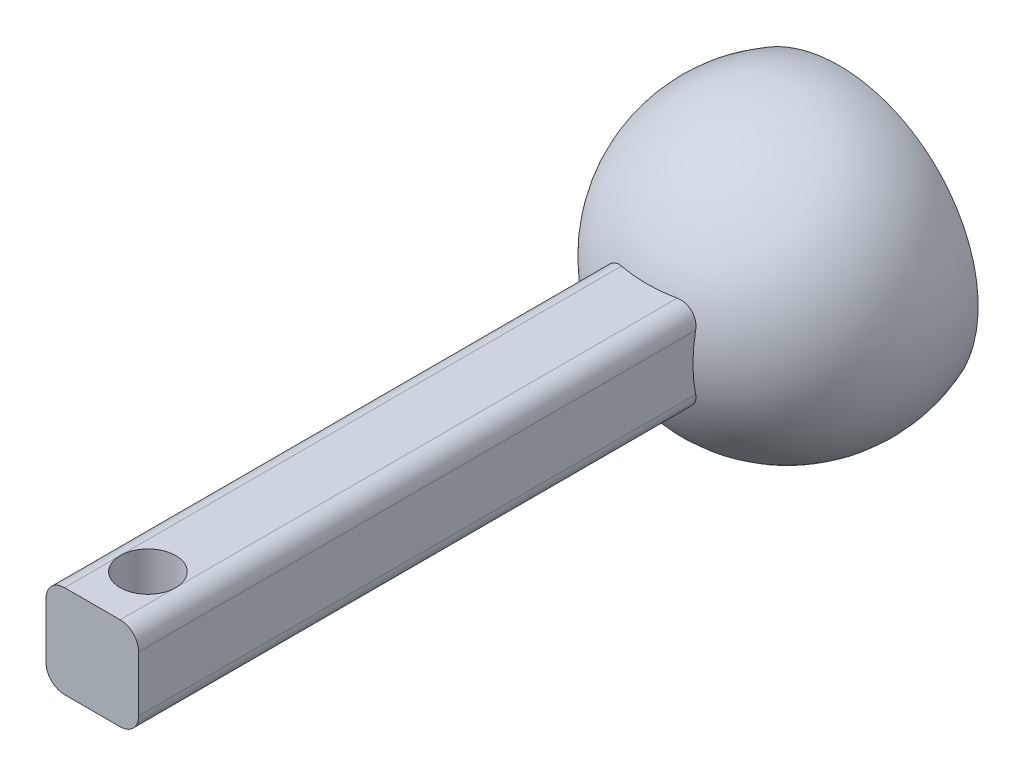
from build123d import *

# Parameters (mm, degrees)
SKETCH3_W           = 5
SKETCH3_H           = 5
BOSS_EXTRUDE1_DEPTH = 37.5
SKETCH4_R           = 1.5
CUT_EXTRUDE1_DEPTH  = 5
SKETCH5_W           = 3.469365962
SKETCH5_H           = 1.189282553
BOSS_EXTRUDE2_DEPTH = 8
SKETCH6_W           = 20.090906928
SKETCH6_H           = 16.444349254
CUT_EXTRUDE2_DEPTH  = 10.5
FILLET5_R           = 1
FILLET6_R           = 1
FILLET7_R           = 1
FILLET8_R           = 1


with BuildPart() as part:
    # Sketch1 → Revolve1 (revolve)
    with BuildSketch(Plane.XY):
        with BuildLine():
            Line((-0.590277778, 15.201388889), (-0.590277778, -0.798611111))
            ThreePointArc((-0.590277778, -0.798611111), (7.409722222, 7.201388889), (-0.590277778, 15.201388889))
        make_face()
    revolve(axis=Axis((-0.590277778, 15.201388889, 0), (0, -1, 0)))

    # Sketch3 → Boss-Extrude1 (add)
    with BuildSketch(Plane(origin=(0, 0, 0), x_dir=(-1, 0, 0), z_dir=(0, 0, -1))):
        with Locations((0.590277778, 7.201388889)):
            Rectangle(SKETCH3_W, SKETCH3_H)
    extrude(amount=-BOSS_EXTRUDE1_DEPTH)

    # Sketch4 → Cut-Extrude1 (cut)
    with BuildSketch(Plane.XZ.offset(-4.701388889)):
        with Locations(Location((-0.590277778, 34.5, 0), (0, 0, 270))):
            Circle(SKETCH4_R)
    extrude(amount=-CUT_EXTRUDE1_DEPTH, mode=Mode.SUBTRACT)


with BuildPart() as body_2:
    # Sketch5 → Boss-Extrude2 (new body)
    with BuildSketch(Plane(origin=(0, 0, 0), x_dir=(1, 0, 0), z_dir=(0, 1, 0))):
        with Locations((0, 12.70312089)):
            Rectangle(SKETCH5_W, SKETCH5_H)
    extrude(amount=BOSS_EXTRUDE2_DEPTH)


with BuildPart() as cut_extrude2_tool:
    # Sketch6 → Cut-Extrude2 (new body)
    with BuildSketch(Plane(origin=(0, 0, -13.297762167), x_dir=(-1, 0, 0), z_dir=(0, 0, -1))):
        with Locations((0.125748138, 7.050416756)):
            Rectangle(SKETCH6_W, SKETCH6_H)
    extrude(amount=-CUT_EXTRUDE2_DEPTH)


with BuildPart() as part_1:
    add(part.part)

    # Cut-Extrude2: cut by cut_extrude2_tool
    add(cut_extrude2_tool.part, mode=Mode.SUBTRACT)

    # Fillet5
    fillet5_edges = [part_1.edges().sort_by_distance(p)[0] for p in [
        (-3.090277778, 9.701388889, 22.338175024),
    ]]
    fillet(fillet5_edges, radius=FILLET5_R - 0.0001)  # a hair under: the kernel refuses the full size

    # Fillet6
    fillet6_edges = [part_1.edges().sort_by_distance(p)[0] for p in [
        (1.909722222, 9.701388889, 22.338175024),
    ]]
    fillet(fillet6_edges, radius=FILLET6_R)

    # Fillet7
    fillet7_edges = [part_1.edges().sort_by_distance(p)[0] for p in [
        (1.909722222, 4.701388889, 22.338175024),
    ]]
    fillet(fillet7_edges, radius=FILLET7_R)

    # Fillet8
    fillet8_edges = [part_1.edges().sort_by_distance(p)[0] for p in [
        (-3.090277778, 4.701388889, 22.338175024),
    ]]
    fillet(fillet8_edges, radius=FILLET8_R - 0.0001)  # a hair under: the kernel refuses the full size


with BuildPart() as body_2_1:
    add(body_2.part)

    # Cut-Extrude2: cut by cut_extrude2_tool
    add(cut_extrude2_tool.part, mode=Mode.SUBTRACT)


solid = part_1.part
